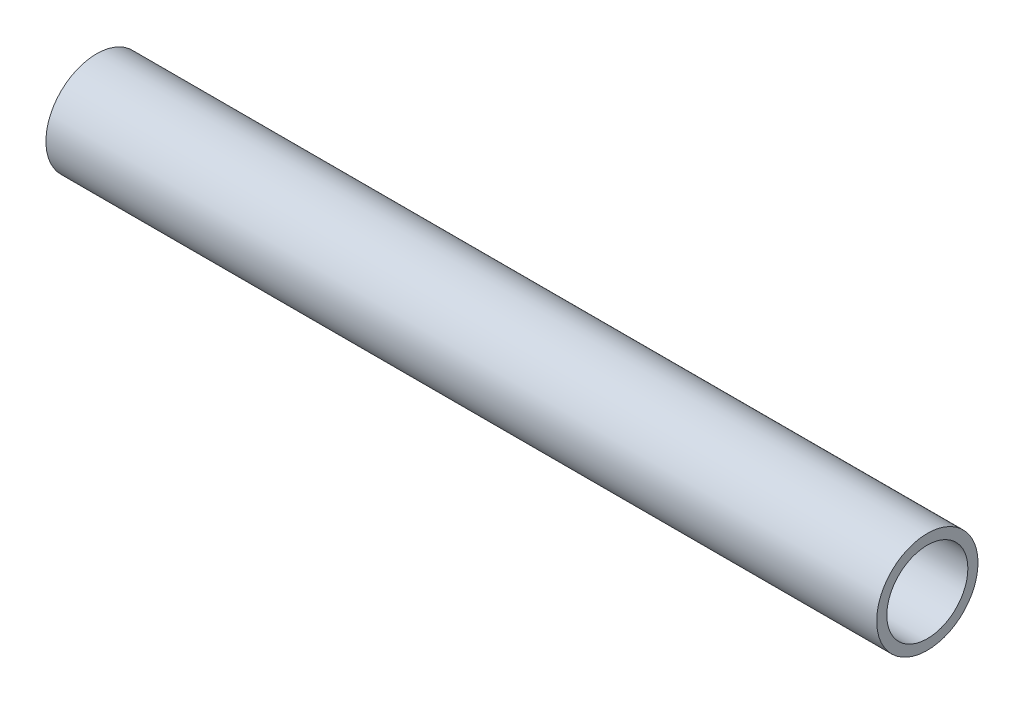
from build123d import *

# Parameters (mm, degrees)
SKETCH1_R           = 15.875
SKETCH1_R_2         = 12.7
EXTRUDE_THIN1_DEPTH = 130.159125


with BuildPart() as part:
    # Sketch1 → Extrude-Thin1 (new, symmetric)
    with BuildSketch(Plane(origin=(0, 0, 0), x_dir=(0, 0, -1), z_dir=(1, 0, 0))):
        Circle(SKETCH1_R)
        Circle(SKETCH1_R_2, mode=Mode.SUBTRACT)
    extrude(amount=EXTRUDE_THIN1_DEPTH, both=True)


solid = part.part
